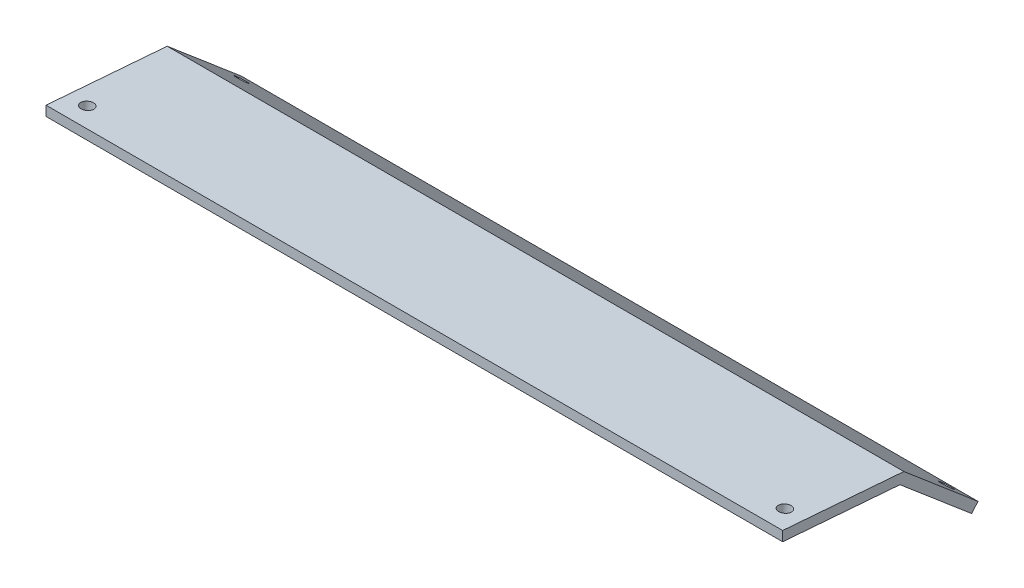
from build123d import *

# Parameters (mm, degrees)
BOSS_EXTRUDE1_DEPTH = 119.85625
SKETCH2_R           = 2.032
CUT_EXTRUDE1_DEPTH  = 139.018532012
SKETCH3_R           = 2.032
CUT_EXTRUDE2_DEPTH  = 12.7


with BuildPart() as part:
    # Sketch1 → Boss-Extrude1 (new, symmetric)
    with BuildSketch(Plane(origin=(0, 0, 0), x_dir=(0, 0, -1), z_dir=(1, 0, 0))):
        Polygon((0, 0), (0, 3.184811635), (39.441694079, 0.081648263), (63.564511378, -20.389838071), (61.510145526, -22.810624296), (38.169699663, -3.00308637), align=None)
    extrude(amount=BOSS_EXTRUDE1_DEPTH, both=True)

    # Sketch2 → Cut-Extrude1 (cut, through all)
    with BuildSketch(Plane(origin=(0, 3.165218593, -0.249030642), x_dir=(1, 0, 0), z_dir=(0, 0.9969192417821154, -0.0784348478966589))):
        with Locations((113.50625, 6.860027305)):
            Circle(SKETCH2_R)
        with Locations((-113.50625, 6.860027305)):
            Circle(SKETCH2_R)
    extrude(amount=-CUT_EXTRUDE1_DEPTH, mode=Mode.SUBTRACT)

    # Sketch3 → Cut-Extrude2 (cut)
    with BuildSketch(Plane(origin=(0, 19.505649868, -16.553192761), x_dir=(1, 0, 0), z_dir=(0, 0.7624523542361142, -0.6470443628684257))):
        with Locations((-113.50625, 53.40304113)):
            Circle(SKETCH3_R)
        with Locations((113.50625, 56.57804113)):
            Circle(SKETCH3_R)
    extrude(amount=-CUT_EXTRUDE2_DEPTH, mode=Mode.SUBTRACT)


solid = part.part
